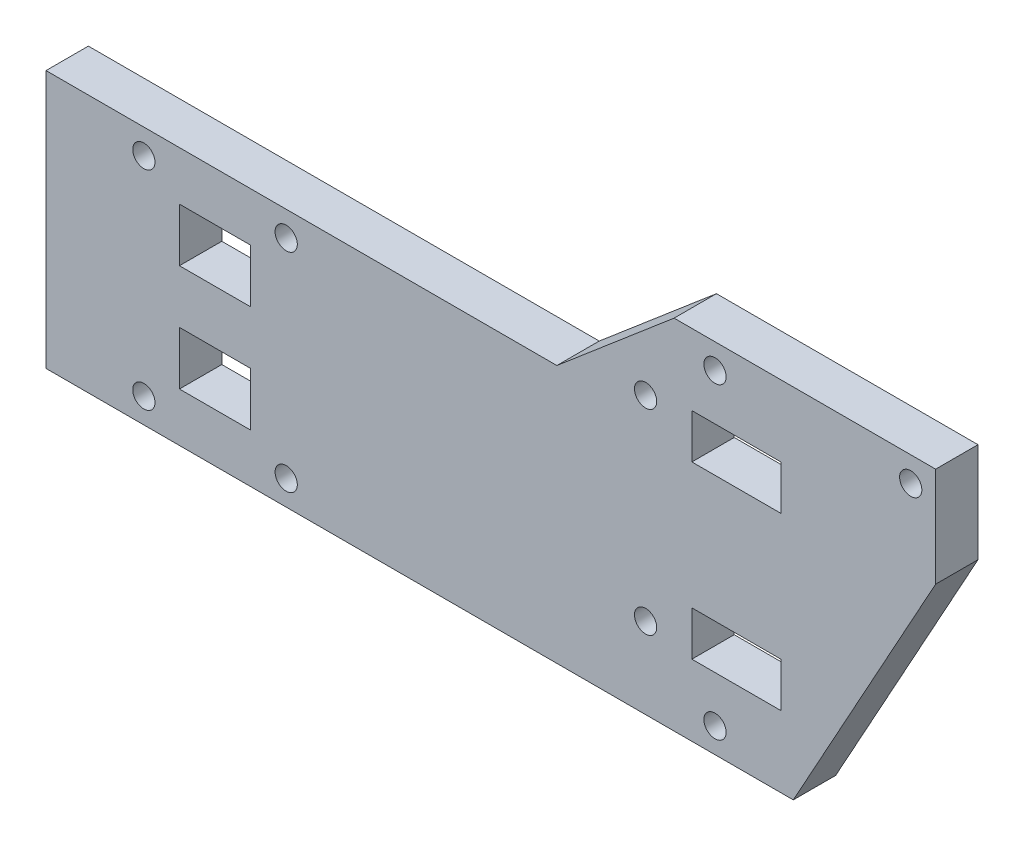
from build123d import *

# Parameters (mm, degrees)
BOSS_EXTRUDE1_DEPTH = 4.7625
SKETCH2_R           = 1.25
SKETCH2_W           = 10
SKETCH2_H           = 5
SKETCH2_W_2         = 8
SKETCH2_H_2         = 6
CUT_EXTRUDE1_DEPTH  = 108.882905997


with BuildPart() as part:
    # Sketch1 → Boss-Extrude1 (new body)
    with BuildSketch(Plane.XY):
        Polygon((70.6, 40.2), (57.423529412, 29), (0, 29), (0, 0), (84, 0), (100, 29), (100, 40.2), align=None)
    extrude(amount=BOSS_EXTRUDE1_DEPTH)

    # Sketch2 → Cut-Extrude1 (cut, through all)
    with BuildSketch(Plane.XY.offset(4.7625)):
        with Locations((97.2, 37.4)):
            Circle(SKETCH2_R)
        with Locations((75.2, 37.4)):
            Circle(SKETCH2_R)
        with Locations((67.4, 31.1)):
            Circle(SKETCH2_R)
        with Locations((67.4, 9.1)):
            Circle(SKETCH2_R)
        with Locations((75.2, 2.8)):
            Circle(SKETCH2_R)
        with Locations((11, 26.2)):
            Circle(SKETCH2_R)
        with Locations((27, 26.2)):
            Circle(SKETCH2_R)
        with Locations((27, 2.8)):
            Circle(SKETCH2_R)
        with Locations((11, 2.8)):
            Circle(SKETCH2_R)
        with Locations((77.6, 29.7)):
            Rectangle(SKETCH2_W, SKETCH2_H)
        with Locations((77.6, 10.5)):
            Rectangle(SKETCH2_W, SKETCH2_H)
        with Locations((19, 20.5)):
            Rectangle(SKETCH2_W_2, SKETCH2_H_2)
        with Locations((19, 8.5)):
            Rectangle(SKETCH2_W_2, SKETCH2_H_2)
    extrude(amount=-CUT_EXTRUDE1_DEPTH, mode=Mode.SUBTRACT)


solid = part.part
